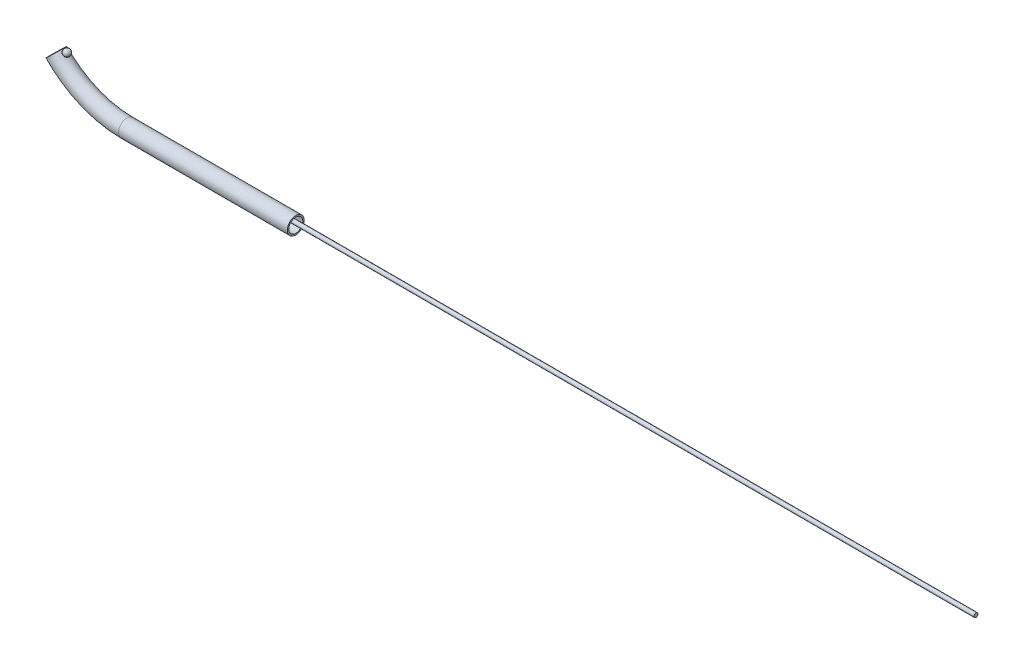
from build123d import *

# Parameters (mm, degrees)
SKETCH5_R           = 0.6223
SKETCH5_R_2         = 0.51435
SKETCH5_2_R         = 0.6223
SKETCH5_2_R_2       = 0.51435
BOSS_EXTRUDE2_DEPTH = 10
SKETCH8_R           = 0.15
SKETCH9_R           = 0.15
BOSS_EXTRUDE3_DEPTH = 50


with BuildPart() as part:
    # Sweep2: sweep along a path in Sketch4
    with BuildLine(Plane.XY) as sweep2_path:
        Line((-65.954222951, 0), (-68.364968213, 0))
        ThreePointArc((-68.364968213, 0), (-71.186123393, 0.579815367), (-73.549932813, 2.225265895))
    # Sketch5 → Sweep2 (sweep)
    with BuildSketch(Plane(origin=(-65.954222951, 0, 0), x_dir=(0, 0, -1), z_dir=(1, 0, 0))):
        Circle(SKETCH5_R)
        Circle(SKETCH5_R_2, mode=Mode.SUBTRACT)
    sweep(path=sweep2_path.line)

    # Sketch5<2> → Boss-Extrude2 (add)
    with BuildSketch(Plane(origin=(-65.954222951, 0, 0), x_dir=(0, 0, -1), z_dir=(1, 0, 0))):
        Circle(SKETCH5_2_R)
        Circle(SKETCH5_2_R_2, mode=Mode.SUBTRACT)
    extrude(amount=BOSS_EXTRUDE2_DEPTH)

    # Sketch6 → Revolve2 (revolve)
    with BuildSketch(Plane.XY):
        with BuildLine():
            Line((-72.949063517, 2.38792888), (-72.625665662, 2.76926053))
            ThreePointArc((-72.625665662, 2.76926053), (-72.596698765, 2.416895777), (-72.949063517, 2.38792888))
        make_face()
    revolve(axis=Axis((-72.949063517, 2.38792888, 0), (0.6467957105420484, 0.7626632997754689, 0)))


with BuildPart() as body_2:
    # Sweep3: sweep along a path in Sketch7
    with BuildLine(Plane.XY) as sweep3_path:
        Line((-55.954222951, 0.1777), (-68.364968213, 0.1777))
        ThreePointArc((-68.364968213, 0.1777), (-71.116040444, 0.743111633), (-73.421128268, 2.347685988))
    # Sketch8 → Sweep3 (sweep)
    with BuildSketch(Plane(origin=(-36.018221468, 37.89664365, 0), x_dir=(0.7248426853938525, 0.688914422429251, 0), z_dir=(-0.688914422429251, 0.7248426853938525, 0))):
        with Locations((-51.601413042, 0)):
            Circle(SKETCH8_R)
    sweep(path=sweep3_path.line)

    # Sketch9 → Boss-Extrude3 (add)
    with BuildSketch(Plane(origin=(-55.954222951, 0, 0), x_dir=(0, 0, -1), z_dir=(1, 0, 0))):
        with Locations((0, 0.1777)):
            Circle(SKETCH9_R)
    extrude(amount=BOSS_EXTRUDE3_DEPTH)


solid = Compound([part.part, body_2.part])
